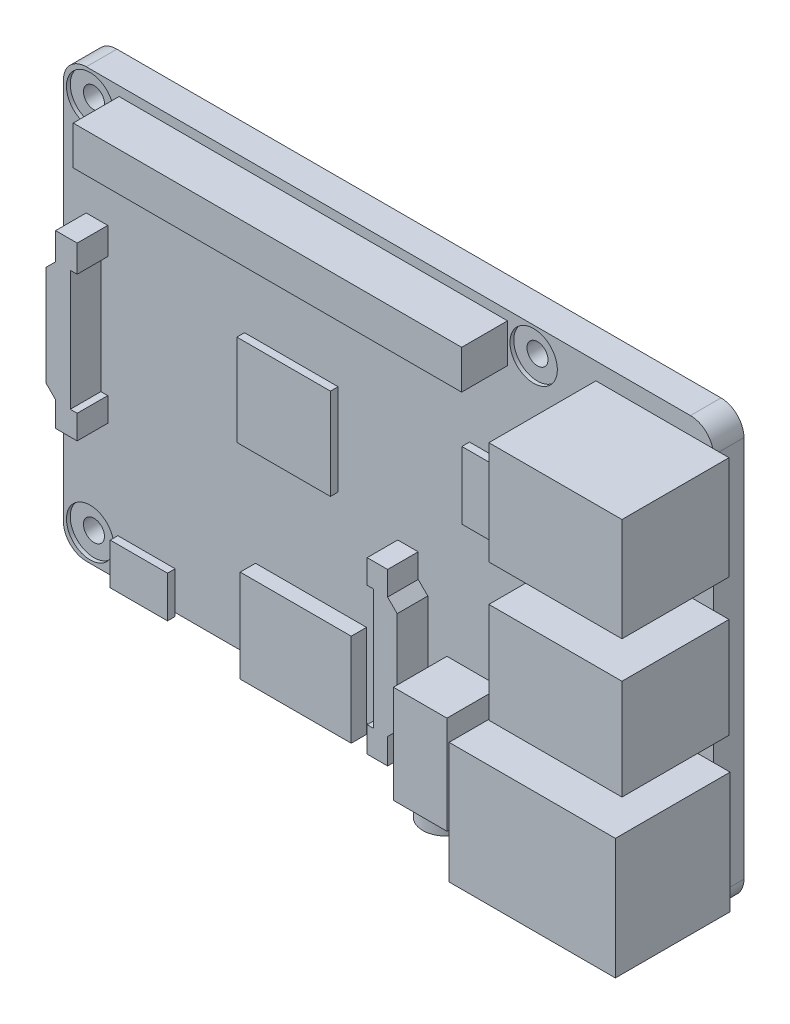
from build123d import *

# Parameters (mm, degrees)
EXTRUDE_START       = -4
EXTRUDE_2_DEPTH     = 4
SKETCH_2_R          = 3.1
CUT_EXTRUDE_1_DEPTH = 0.5
SKETCH_3_R          = 1.375
CUT_EXTRUDE_2_DEPTH = 4
SKETCH_4_W          = 50.8
SKETCH_4_H          = 5.08
EXTRUDE_3_DEPTH     = 6
SKETCH_5_W          = 12.235874624
SKETCH_5_H          = 11.932505832
EXTRUDE_4_DEPTH     = 1
SKETCH_6_W          = 17.407120639
SKETCH_6_H          = 13.510004078
SKETCH_6_H_2        = 13.120292422
EXTRUDE_5_DEPTH     = 14
SKETCH_7_W          = 21.748003317
SKETCH_7_H          = 15.815488158
EXTRUDE_6_DEPTH     = 15
SKETCH_8_W          = 9.2021867
SKETCH_8_H          = 8.797694978
EXTRUDE_7_DEPTH     = 1
SKETCH_9_W          = 14.519457286
SKETCH_9_H          = 12.125029798
EXTRUDE_8_DEPTH     = 2
SKETCH_10_W         = 7
SKETCH_10_H         = 12.812960392
EXTRUDE_9_DEPTH     = 7
SKETCH_11_R         = 3
SKETCH_11_R_2       = 2
EXTRUDE_1_DEPTH     = 2
EXTRUDE_10_DEPTH    = 4
SKETCH_13_W         = 7.492652901
SKETCH_13_H         = 5.40798094
EXTRUDE_11_DEPTH    = 1
EXTRUDE_12_DEPTH    = 4
CUT_EXTRUDE_START   = -0.5
SKETCH_15_R         = 3.1
CUT_EXTRUDE_3_DEPTH = 0.5


# Read off the part's stored shape, not the designer's step: 凸台-拉伸2
with BuildPart() as part:
    # 凸台-拉伸2 outline → 凸台-拉伸2 (new body)
    with BuildSketch(Plane.XY.offset(EXTRUDE_START)):
        with BuildLine():
            ThreePointArc((3, 56), (0.878679656, 55.121320344), (0, 53))
            Line((0, 53), (0, 3))
            ThreePointArc((0, 3), (0.878679656, 0.878679656), (3, 0))
            Line((3, 0), (82, 0))
            ThreePointArc((82, 0), (84.121320344, 0.878679656), (85, 3))
            Line((85, 3), (85, 53))
            ThreePointArc((85, 53), (84.121320344, 55.121320344), (82, 56))
            Line((82, 56), (3, 56))
        make_face()
    extrude(amount=EXTRUDE_2_DEPTH)

    # 草图2 → 切除-拉伸1 (cut)
    with BuildSketch(Plane.XY):
        with Locations((3.5, 3.5)):
            Circle(SKETCH_2_R)
        with Locations((61.5, 3.5)):
            Circle(SKETCH_2_R)
        with Locations((3.5, 52.5)):
            Circle(SKETCH_2_R)
        with Locations((61.5, 52.5)):
            Circle(SKETCH_2_R)
    extrude(amount=-CUT_EXTRUDE_1_DEPTH, mode=Mode.SUBTRACT)

    # 草图3 → 切除-拉伸2 (cut)
    with BuildSketch(Plane.XY):
        with Locations((3.5, 52.5)):
            Circle(SKETCH_3_R)
        with Locations((61.5, 52.5)):
            Circle(SKETCH_3_R)
        with Locations((3.5, 3.5)):
            Circle(SKETCH_3_R)
        with Locations((61.5, 3.5)):
            Circle(SKETCH_3_R)
    extrude(amount=-CUT_EXTRUDE_2_DEPTH, mode=Mode.SUBTRACT)

    # 草图4 → 凸台-拉伸3 (add)
    with BuildSketch(Plane.XY):
        with Locations((32.682745254, 52.232035351)):
            Rectangle(SKETCH_4_W, SKETCH_4_H)
    extrude(amount=EXTRUDE_3_DEPTH)

    # 草图5 → 凸台-拉伸4 (add)
    with BuildSketch(Plane.XY):
        with Locations((29.806273598, 30.264010216)):
            Rectangle(SKETCH_5_W, SKETCH_5_H)
    extrude(amount=EXTRUDE_4_DEPTH)

    # 草图6 → 凸台-拉伸5 (add)
    with BuildSketch(Plane.XY):
        with Locations((78.345183612, 46.994971673)):
            Rectangle(SKETCH_6_W, SKETCH_6_H)
        with Locations((78.345183612, 28.873379664)):
            Rectangle(SKETCH_6_W, SKETCH_6_H_2)
    extrude(amount=EXTRUDE_5_DEPTH)

    # 草图7 → 凸台-拉伸6 (add)
    with BuildSketch(Plane.XY):
        with Locations((76.314084713, 10.301990913)):
            Rectangle(SKETCH_7_W, SKETCH_7_H)
    extrude(amount=EXTRUDE_6_DEPTH)

    # 草图8 → 凸台-拉伸7 (add)
    with BuildSketch(Plane.XY):
        with Locations((57.716202493, 34.157243051)):
            Rectangle(SKETCH_8_W, SKETCH_8_H)
    extrude(amount=EXTRUDE_7_DEPTH)

    # 草图9 → 凸台-拉伸8 (add)
    with BuildSketch(Plane.XY):
        with Locations((32.383118315, 4.770804671)):
            Rectangle(SKETCH_9_W, SKETCH_9_H)
    extrude(amount=EXTRUDE_8_DEPTH)

    # 草图10 → 凸台-拉伸9 (add)
    with BuildSketch(Plane.XY):
        with Locations((53.659033893, 6.406480196)):
            Rectangle(SKETCH_10_W, SKETCH_10_H)
    extrude(amount=EXTRUDE_9_DEPTH)

    # 草图11 → 拉伸-薄壁1 (add)
    with BuildSketch(Plane(origin=(0, 0, 0), x_dir=(-1, 0, 0), z_dir=(0, -1, 0))):
        with Locations((-53.5, -3.5)):
            Circle(SKETCH_11_R)
        with Locations((-53.5, -3.5)):
            Circle(SKETCH_11_R_2, mode=Mode.SUBTRACT)
    extrude(amount=EXTRUDE_1_DEPTH)

    # 草图12 → 凸台-拉伸10 (add)
    with BuildSketch(Plane.XY):
        Polygon((43.726404027, 3.853526794), (43.726404027, 0.513143902), (46.402655395, 0.513143902), (46.402655395, 3.853526794), (47.65405595, 5.104927349), (47.65405595, 18.391456575), (46.402655395, 19.64285713), (46.402655395, 22.77278121), (43.726404027, 22.77278121), (43.726404027, 19.64285713), (44.555447726, 19.64285713), (44.555447726, 3.853526794), align=None)
    extrude(amount=EXTRUDE_10_DEPTH)

    # 草图13 → 凸台-拉伸11 (add)
    with BuildSketch(Plane.XY):
        with Locations((10.870809128, 2.254112914)):
            Rectangle(SKETCH_13_W, SKETCH_13_H)
    extrude(amount=EXTRUDE_11_DEPTH)

    # 草图14 → 凸台-拉伸12 (add)
    with BuildSketch(Plane.XY):
        Polygon((2.981536039, 17.027603439), (5.803149545, 17.027603439), (5.803149545, 20.162023057), (4.903155557, 20.162023057), (4.903155557, 35.905554668), (5.803149545, 35.905554668), (5.803149545, 39.436558403), (2.981536039, 39.436558403), (2.981536039, 35.905554668), (1.735405071, 34.659423699), (1.735405071, 21.530793828), (2.981536039, 20.28466286), align=None)
    extrude(amount=EXTRUDE_12_DEPTH)

    # 草图15 → 切除-拉伸3 (cut)
    with BuildSketch(Plane(origin=(0, 0, -4), x_dir=(-1, 0, 0), z_dir=(0, 0, -1)).offset(CUT_EXTRUDE_START)):
        with Locations(Location((-61.5, 52.5, 0), (0, 0, 180))):
            Circle(SKETCH_15_R)
        with Locations(Location((-61.5, 3.5, 0), (0, 0, 180))):
            Circle(SKETCH_15_R)
        with Locations(Location((-3.5, 52.5, 0), (0, 0, 180))):
            Circle(SKETCH_15_R)
        with Locations(Location((-3.5, 3.5, 0), (0, 0, 180))):
            Circle(SKETCH_15_R)
    extrude(amount=CUT_EXTRUDE_3_DEPTH, mode=Mode.SUBTRACT)


solid = part.part
